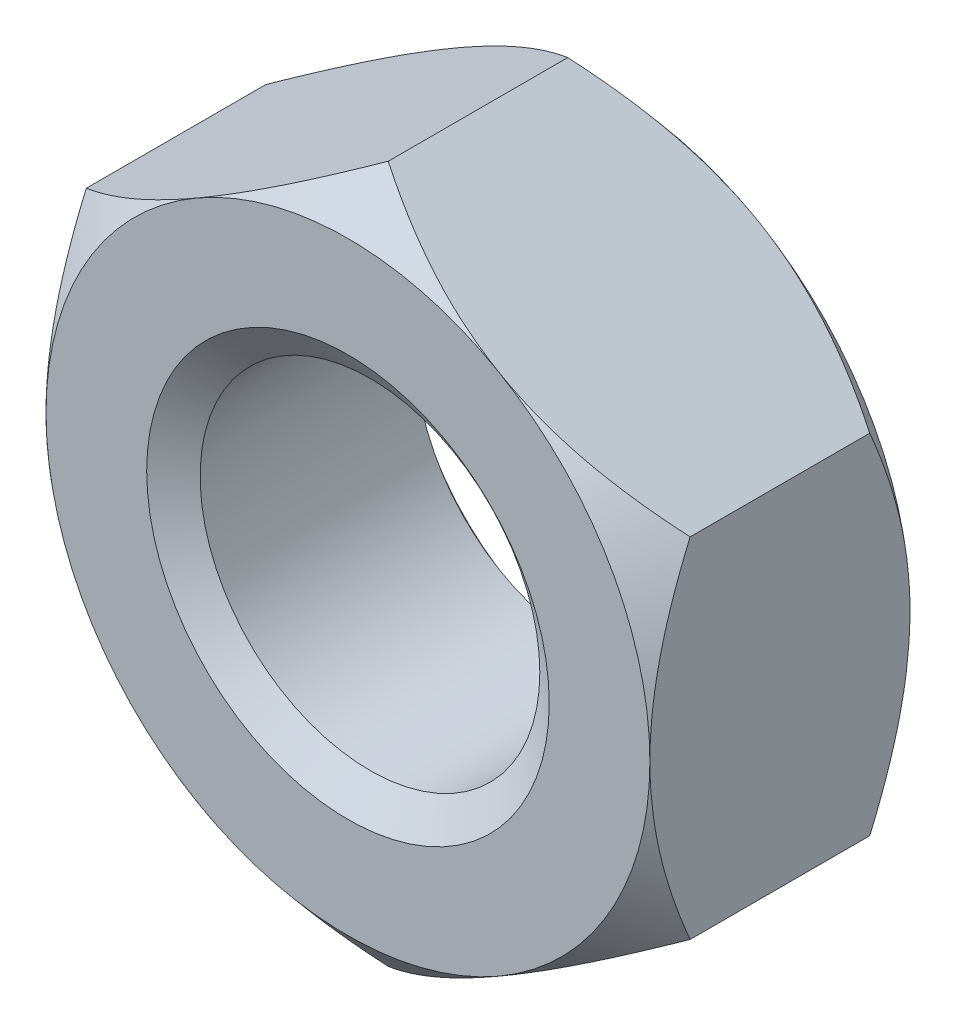
from build123d import *

# Parameters (mm, degrees)
THREADSCHEMATIC_START     = -8.2042
THREADSCHEMATIC_OUTLINE_R = 5.35813
THREADSCHEMATIC_DEPTH     = 8.2042


# Read off the part's stored shape, not the designer's step: ThreadSchematic
with BuildPart() as part:
    # ThreadSchematic outline → ThreadSchematic (new body)
    with BuildSketch(Plane.XY.offset(THREADSCHEMATIC_START)):
        Polygon((9.525, 5.499261314), (0, 10.998522628), (-9.525, 5.499261314), (-9.525, -5.499261314), (0, -10.998522628), (9.525, -5.499261314), align=None)
        Circle(THREADSCHEMATIC_OUTLINE_R, mode=Mode.SUBTRACT)
    extrude(amount=THREADSCHEMATIC_DEPTH)

    # Sketch3 → Double-Chamfer (revolve, cut)
    with BuildSketch(Plane(origin=(0, 0, 0), x_dir=(0, 0, -1), z_dir=(1, 0, 0))):
        Polygon((8.2042, 9.525), (6.9342, 10.998522628), (6.9342, 23.698522628), (20.9042, 23.698522628), (20.9042, 9.525), align=None)
        Polygon((1.27, 23.698522628), (-12.7, 23.698522628), (-12.7, 9.525), (0, 9.525), (1.27, 10.998522628), align=None)
    revolve(axis=Axis((0, 0, 0), (0, 0, -1)), mode=Mode.SUBTRACT)

    # EndChamferSke → EndChamfer (revolve, cut)
    with BuildSketch(Plane(origin=(0, 0, 0), x_dir=(0, 0, -1), z_dir=(1, 0, 0)), mode=Mode.PRIVATE) as endchamfer_sk:
        Polygon((8.1788, 6.35), (7.414833664, 5.258943), (8.2296, 5.258943), (8.2296, 6.35), align=None)
        Polygon((-0.0508, 6.35), (0, 6.35), (0.763966336, 5.258943), (-0.0508, 5.258943), align=None)
    revolve(endchamfer_sk.sketch.rotate(Axis((0, 0, -25.037505729), (0, 0, -1)), 90), axis=Axis((0, 0, -25.037505729), (0, 0, -1)), mode=Mode.SUBTRACT)


solid = part.part
